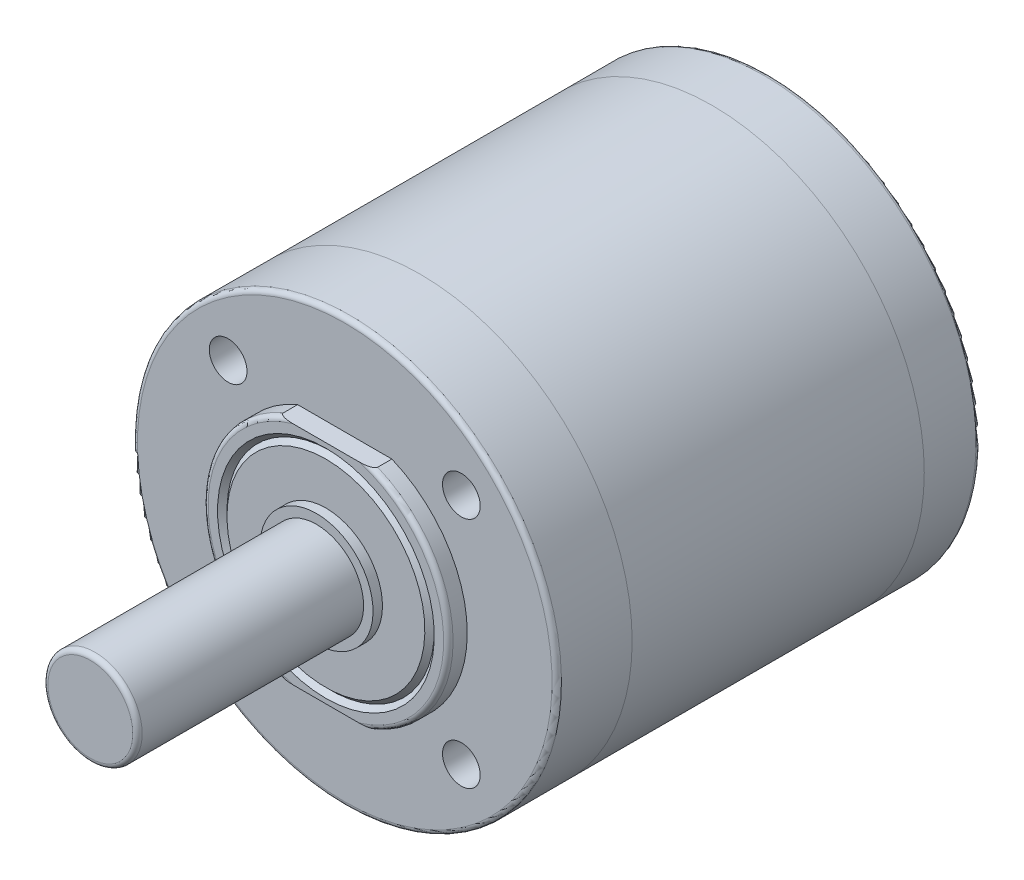
from build123d import *

# Parameters (mm, degrees)
FILLET1_R          = 0.5
CUT_EXTRUDE1_DEPTH = 2
SKETCH4_R          = 2
CUT_EXTRUDE2_DEPTH = 8


with BuildPart() as part:
    # Sketch1 → Revolve1 (revolve)
    with BuildSketch(Plane(origin=(0, 0, 0), x_dir=(0, 0, -1), z_dir=(1, 0, 0))):
        Polygon((0, 0), (0, 22.5), (-45, 22.5), (-45, 13), (-47, 13), (-47, 11.5), (-46.5, 11), (-47, 10.5), (-47, 6), (-48, 6), (-48, 5), (-72, 5), (-72, 0), align=None)
    revolve(axis=Axis((0, 0, 0), (0, 0, 1)))

    # Fillet1
    fillet1_edges = [part.edges().sort_by_distance(p)[0] for p in [
        (0, -22.5, 0),
        (0, -22.5, 45),
        (0, -13, 47),
        (0, -5, 72),
    ]]
    fillet(fillet1_edges, radius=FILLET1_R)

    # Sketch3 → Cut-Extrude1 (cut)
    with BuildSketch(Plane.XY.offset(47)):
        with BuildLine():
            Line((-5, 12), (5, 12))
            ThreePointArc((5, 12), (0, 13), (-5, 12))
        make_face()
        with BuildLine():
            Line((-5, -12), (5, -12))
            ThreePointArc((5, -12), (0, -13), (-5, -12))
        make_face()
    extrude(amount=-CUT_EXTRUDE1_DEPTH, mode=Mode.SUBTRACT)

    # Sketch4 → Cut-Extrude2 (cut)
    with BuildSketch(Plane.XY.offset(45)):
        with Locations((-12.374368671, 12.374368671)):
            Circle(SKETCH4_R)
        with Locations((12.374368671, 12.374368671)):
            Circle(SKETCH4_R)
        with Locations((12.374368671, -12.374368671)):
            Circle(SKETCH4_R)
        with Locations((-12.374368671, -12.374368671)):
            Circle(SKETCH4_R)
    extrude(amount=-CUT_EXTRUDE2_DEPTH, mode=Mode.SUBTRACT)


solid = part.part
